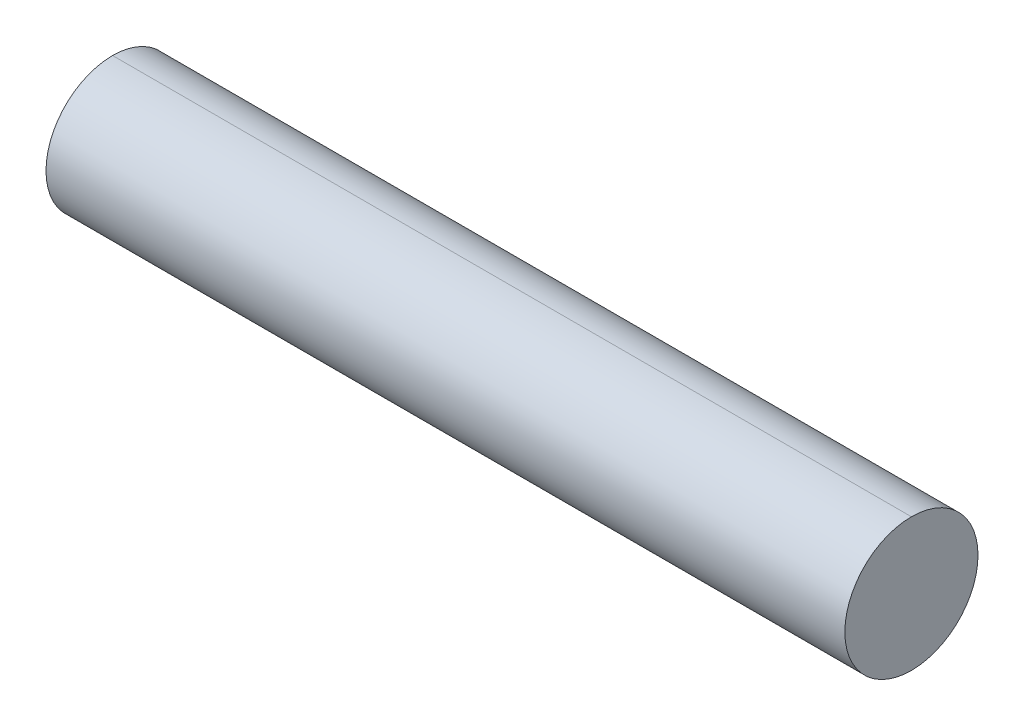
from build123d import *

# Parameters (mm, degrees)
SKETCH1_R           = 19.05
BOSS_EXTRUDE1_DEPTH = 228.6


with BuildPart() as part:
    # Sketch1 → Boss-Extrude1 (new body)
    with BuildSketch(Plane(origin=(0, 0, 0), x_dir=(0, 0, -1), z_dir=(1, 0, 0))):
        Circle(SKETCH1_R)
    extrude(amount=BOSS_EXTRUDE1_DEPTH)


solid = part.part
